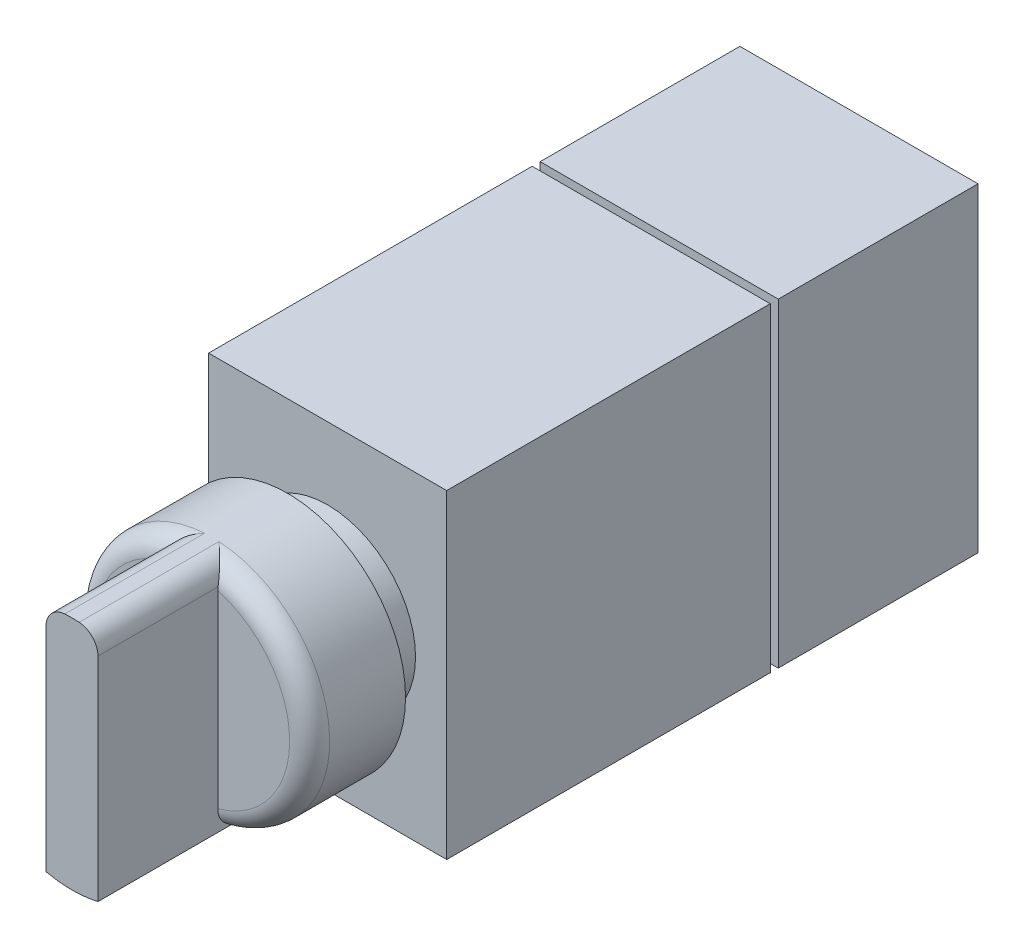
from build123d import *

# Parameters (mm, degrees)
SKETCH1_R           = 14.75
BOSS_EXTRUDE1_DEPTH = 12
BOSS_EXTRUDE2_DEPTH = 15
FILLET1_START       = 12
FILLET1_DEPTH       = 16
FILLET1_START_2     = 9.4999999
FILLET1_2_DEPTH     = 2.5000001
SKETCH3_R           = 11
BOSS_EXTRUDE3_DEPTH = 15
BOSS_EXTRUDE4_START = 5
SKETCH4_W           = 29.8
SKETCH4_H           = 40
BOSS_EXTRUDE4_DEPTH = 40.5
BOSS_EXTRUDE6_START = 1
SKETCH6_W           = 29.8
SKETCH6_H           = 40
BOSS_EXTRUDE6_DEPTH = 25


with BuildPart() as part:
    # Sketch1 → Boss-Extrude1 (new body)
    with BuildSketch(Plane.XY):
        Circle(SKETCH1_R)
    extrude(amount=BOSS_EXTRUDE1_DEPTH)

    # Sketch2 → Boss-Extrude2 (add)
    with BuildSketch(Plane.XY.offset(12)):
        with BuildLine():
            Line((-3.25, 14.38749457), (-3.25, -14.38749457))
            ThreePointArc((-3.25, -14.38749457), (0, -14.75), (3.25, -14.38749457))
            Line((3.25, -14.38749457), (3.25, 14.38749457))
            ThreePointArc((3.25, 14.38749457), (0, 14.75), (-3.25, 14.38749457))
        make_face()
    extrude(amount=BOSS_EXTRUDE2_DEPTH)

    # Fillet1: read off the stored shape, not the designer's step
    # Fillet1 outline → Fillet1 (cut)
    with BuildSketch(Plane.XY.offset(FILLET1_START)):
        with BuildLine():
            Line((-3.25, 14.38749457), (-3.25, 12.227019261))
            ThreePointArc((-3.25, 12.227019261), (-2.571078397, 13.939816234), (-0.903061224, 14.722329314))
            ThreePointArc((-0.903061224, 14.722329314), (-2.083268576, 14.602139982), (-3.25, 14.38749457))
        make_face()
        with BuildLine():
            ThreePointArc((3.25, 14.38749457), (2.083268576, 14.602139982), (0.903061224, 14.722329314))
            ThreePointArc((0.903061224, 14.722329314), (2.571078397, 13.939816234), (3.25, 12.227019261))
            Line((3.25, 12.227019261), (3.25, 14.38749457))
        make_face()
    extrude(amount=FILLET1_DEPTH, mode=Mode.SUBTRACT)

    # Fillet1 2 outline → Fillet1 2 (cut)
    with BuildSketch(Plane.XY.offset(FILLET1_START_2)):
        with BuildLine():
            Line((-3.25, -14.38749457), (-3.25, 12.227019261))
            ThreePointArc((-3.25, 12.227019261), (-2.571078397, 13.939816234), (-0.903061224, 14.722329314))
            ThreePointArc((-0.903061224, 14.722329314), (-14.702293733, 1.185351838), (-3.25, -14.38749457))
        make_face()
        with BuildLine():
            ThreePointArc((3.25, -14.38749457), (14.702293733, 1.185351838), (0.903061224, 14.722329314))
            ThreePointArc((0.903061224, 14.722329314), (2.571078397, 13.939816234), (3.25, 12.227019261))
            Line((3.25, 12.227019261), (3.25, -14.38749457))
        make_face()
    extrude(amount=FILLET1_2_DEPTH, mode=Mode.SUBTRACT)

    # Fillet1 3 outline → Fillet1 3 (revolve)
    with BuildSketch(Plane.XZ):
        with BuildLine():
            Line((12.25, 12), (0, 12))
            Line((0, 12), (0, 9.4999999))
            Line((0, 9.4999999), (14.75, 9.5))
            ThreePointArc((14.75, 9.5), (14.017766953, 11.267766953), (12.25, 12))
        make_face()
    revolve(axis=Axis((0, 0, 0), (0, 0, 1)))

    # Sketch3 → Boss-Extrude3 (add)
    with BuildSketch(Plane(origin=(0, 0, 0), x_dir=(-1, 0, 0), z_dir=(0, 0, -1))):
        with Locations(Location((0, 0, 0), (0, 0, 180))):
            Circle(SKETCH3_R)
    extrude(amount=BOSS_EXTRUDE3_DEPTH)

    # Sketch4 → Boss-Extrude4 (add)
    with BuildSketch(Plane(origin=(0, 0, 0), x_dir=(-1, 0, 0), z_dir=(0, 0, -1)).offset(BOSS_EXTRUDE4_START)):
        Rectangle(SKETCH4_W, SKETCH4_H)
    extrude(amount=BOSS_EXTRUDE4_DEPTH)


with BuildPart() as body_2:
    # Sketch6 → Boss-Extrude6 (new body)
    with BuildSketch(Plane(origin=(0, 0, -45.5), x_dir=(-1, 0, 0), z_dir=(0, 0, -1)).offset(BOSS_EXTRUDE6_START)):
        Rectangle(SKETCH6_W, SKETCH6_H)
    extrude(amount=BOSS_EXTRUDE6_DEPTH)


solid = Compound([part.part, body_2.part])
